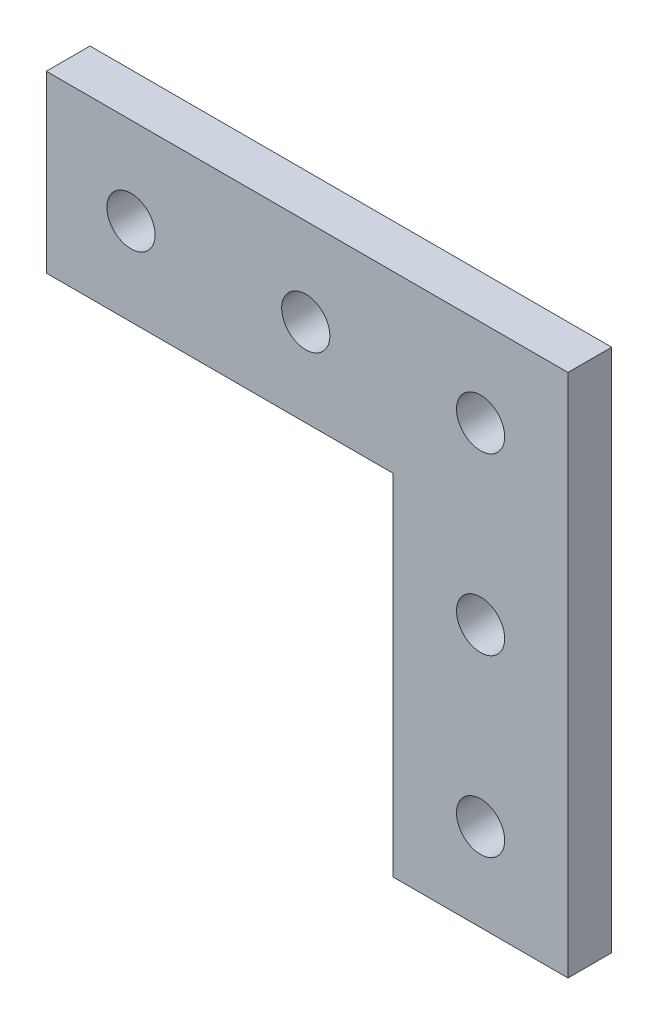
from build123d import *

# Parameters (mm, degrees)
BOSS_EXTRUDE1_DEPTH = 6.35
SKETCH2_R           = 3.5
CUT_EXTRUDE1_DEPTH  = 100.13814856


with BuildPart() as part:
    # Sketch1 → Boss-Extrude1 (new body)
    with BuildSketch(Plane.XY):
        Polygon((12.7, 0), (-12.7, 0), (-12.7, 50.8), (-63.1, 50.8), (-63.1, 76.2), (12.7, 76.2), (12.7, 50.8), align=None)
    extrude(amount=BOSS_EXTRUDE1_DEPTH)

    # Sketch2 → Cut-Extrude1 (cut, through all)
    with BuildSketch(Plane.XY.offset(6.35)):
        with Locations((0, 63.5)):
            Circle(SKETCH2_R)
        with Locations((-25.4, 63.5)):
            Circle(SKETCH2_R)
        with Locations((0, 38.1)):
            Circle(SKETCH2_R)
        with Locations((0, 12.7)):
            Circle(SKETCH2_R)
        with Locations((-50.8, 63.5)):
            Circle(SKETCH2_R)
    extrude(amount=-CUT_EXTRUDE1_DEPTH, mode=Mode.SUBTRACT)


solid = part.part
